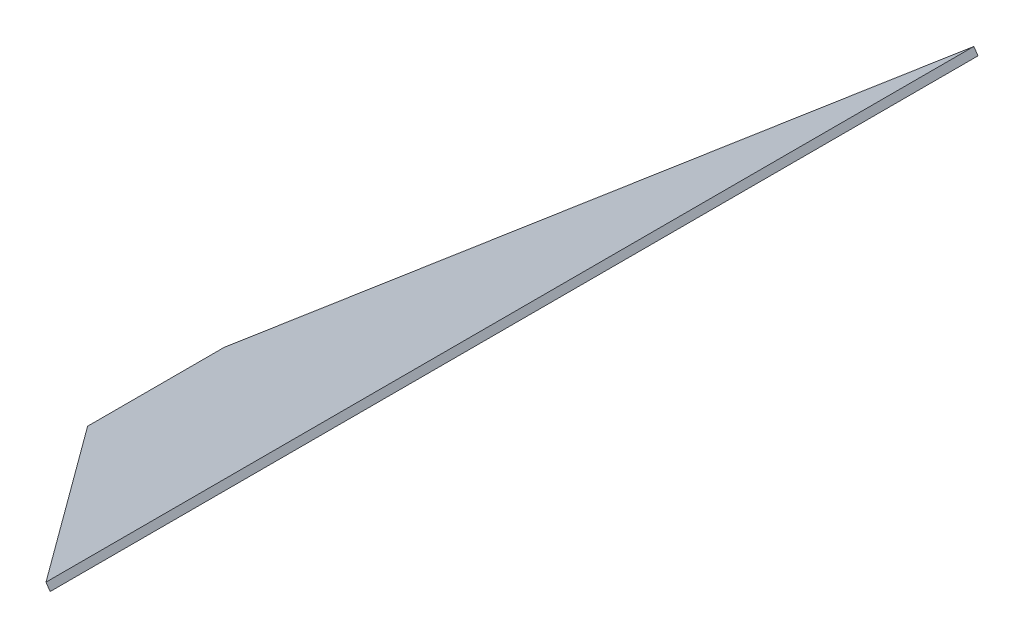
from build123d import *

# Parameters (mm, degrees)
BOSS_EXTRUDE1_DEPTH = 787.4
CAVITY1_START       = 209.393974514
CAVITY1_DEPTH       = 6.25
CUT_EXTRUDE1_DEPTH  = 897.209643935


# Read off the part's stored shape, not the designer's step: Cavity1
with BuildPart() as part:
    # Sketch1 → Boss-Extrude1 (new body)
    with BuildSketch(Plane.XY):
        Polygon((50, 38.1), (46.495004217, 43.274698499), (346.495004217, 246.474698499), (350, 241.3), align=None)
    extrude(amount=BOSS_EXTRUDE1_DEPTH)

    # Cavity1 outline → Cavity1 (cut)
    with BuildSketch(Plane(origin=(0, 0, 0), x_dir=(0.9998289109489032, -0.015681339287170415, -0.009810424501047896), z_dir=(0.018497265493313195, 0.8476202272914186, 0.5302808703467569)).offset(CAVITY1_START)):
        Polygon((42.517859439, -261.403351104), (42.802335744, -261.406643092), (342.564789453, 130.215073828), (188.320866524, 132), (41, 132), (41, -261.385786284), align=None)
    extrude(amount=CAVITY1_DEPTH, mode=Mode.SUBTRACT)

    # Sketch2 → Cut-Extrude1 (cut, through all)
    with BuildSketch(Plane(origin=(-5.470595054, 8.076665927, 0), x_dir=(0.8279517598753687, 0.5607993253555854, 0), z_dir=(-0.5607993253555854, 0.8279517598753687, 0))):
        Polygon((63.112893973, -335.543438937), (425.103993165, -0.59935118), (425.103993165, 0), (62.76404229, 0), (62.76404229, -335.417163823), align=None)
        with BuildLine():
            Line((425.103993165, -787.4), (425.103993165, -786.80064882))
            Line((425.103993165, -786.80064882), (63.112893973, -451.856561063))
            ThreePointArc((63.112893973, -451.856561063), (62.938468131, -451.856470391), (62.76404229, -451.856561063))
            Line((62.76404229, -451.856561063), (62.76404229, -787.4))
            Line((62.76404229, -787.4), (425.103993165, -787.4))
        make_face()
    extrude(amount=-CUT_EXTRUDE1_DEPTH, mode=Mode.SUBTRACT)


solid = part.part
